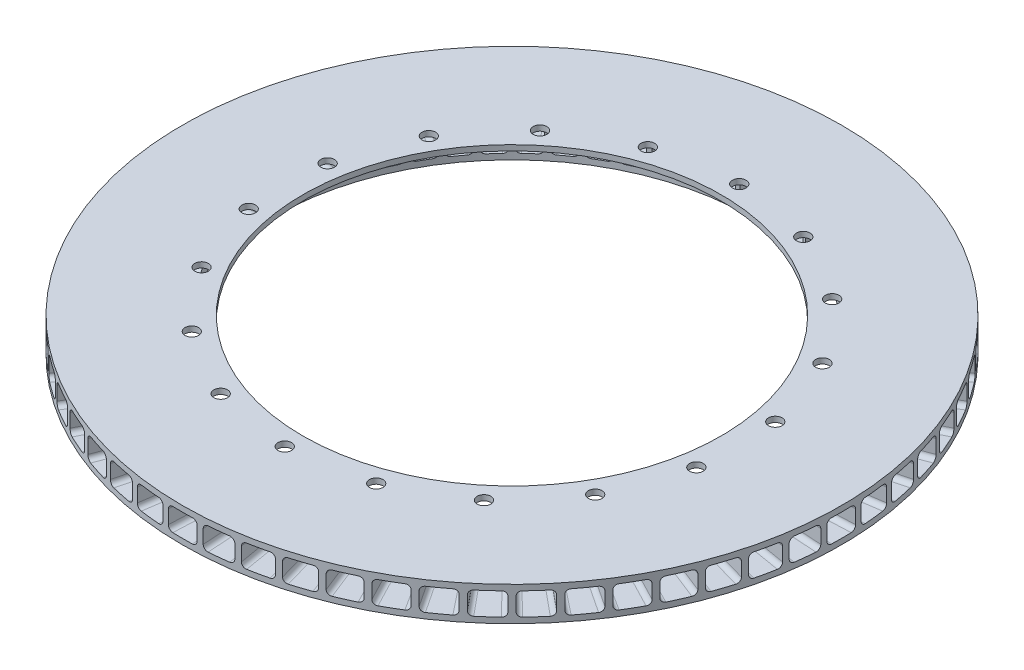
from build123d import *

# Parameters (mm, degrees)
SKETCH1_R           = 145
BOSS_EXTRUDE1_DEPTH = 7.5
CUT_EXTRUDE1_REACH  = 207.609
SKETCH2_R           = 105
SKETCH3_W           = 45
SKETCH3_H           = 10
CUT_REVOLVE1_ANGLE  = 5
CIRPATTERN1_COUNT   = 60
FILLET2_R           = 2
SKETCH6_R           = 105
SKETCH6_R_2         = 92
BOSS_EXTRUDE2_DEPTH = 2.4
CUT_EXTRUDE2_REACH  = 207.609
SKETCH7_R           = 3
CIRPATTERN2_COUNT   = 18


with BuildPart() as part:
    # Sketch1 → Boss-Extrude1 (new, symmetric)
    with BuildSketch(Plane(origin=(0, 0, 0), x_dir=(1, 0, 0), z_dir=(0, 1, 0))):
        Circle(SKETCH1_R)
    extrude(amount=BOSS_EXTRUDE1_DEPTH, both=True)

    # Sketch2 → Cut-Extrude1 (cut, up to next)
    with BuildSketch(Plane(origin=(0, 7.5, 0), x_dir=(1, 0, 0), z_dir=(0, 1, 0)), mode=Mode.PRIVATE) as cut_extrude1_sk1:
        Circle(SKETCH2_R)
    cut_extrude1_tool1 = extrude(cut_extrude1_sk1.sketch, amount=-CUT_EXTRUDE1_REACH, mode=Mode.PRIVATE) & part.part
    add(cut_extrude1_tool1.solids().sort_by_distance((0, 7.5, 0))[0], mode=Mode.SUBTRACT)

    # Sketch3 → Cut-Revolve1 (revolve, symmetric, cut)
    with BuildSketch(Plane(origin=(0, 0, 0), x_dir=(0, 0, -1), z_dir=(1, 0, 0))) as cut_revolve1_sk:
        with Locations((-126.5, 0)):
            Rectangle(SKETCH3_W, SKETCH3_H)
    cut_revolve1 = revolve(axis=Axis((0, 40.26124579, 0), (0, -1, 0)), revolution_arc=CUT_REVOLVE1_ANGLE / 2, mode=Mode.SUBTRACT)
    cut_revolve1 = cut_revolve1 + revolve(cut_revolve1_sk.sketch, axis=Axis((0, 40.26124579, 0), (0, 1, 0)), revolution_arc=CUT_REVOLVE1_ANGLE / 2, mode=Mode.SUBTRACT)

    # CirPattern1: Cut-Revolve1 ×60 about axis
    cirpattern1_axis = Axis((0, 7.5, 0), (0, 1, 0))
    for i in range(1, CIRPATTERN1_COUNT):
        add(cut_revolve1.rotate(cirpattern1_axis, i * 360 / CIRPATTERN1_COUNT), mode=Mode.SUBTRACT)

    # Fillet2
    fillet2_edges = [part.edges().sort_by_distance(p)[0] for p in [
        (-18.476176391, 5, 123.62698292),
        (-7.631067442, 5, 124.766849803),
        (-7.631067442, -5, 124.766849803),
        (-18.476176391, -5, 123.62698292),
        (-43.775922657, 5, 117.084023656),
        (-33.40479701, 5, 120.453806651),
        (-33.40479701, -5, 120.453806651),
        (-43.775922657, -5, 117.084023656),
        (-67.162451043, 5, 105.423930727),
        (-57.718576654, 5, 110.876354147),
        (-57.718576654, -5, 110.876354147),
        (-67.162451043, -5, 105.423930727),
        (-87.613658037, 5, 89.156306144),
        (-79.509777535, 5, 96.453072923),
        (-79.509777535, -5, 96.453072923),
        (-87.613658037, -5, 89.156306144),
        (-97.826019607, -5, 77.81432958),
        (-104.235727758, -5, 68.992123164),
        (-116.302195998, 5, 45.812653341),
        (-111.8667952, 5, 55.774726639),
        (-111.8667952, -5, 55.774726639),
        (-116.302195998, -5, 45.812653341),
        (-123.285700192, 5, 20.630950733),
        (-121.018455047, 5, 31.297500507),
        (-121.018455047, -5, 31.297500507),
        (-123.285700192, -5, 20.630950733),
        (-124.881027698, 5, -5.452423421),
        (-124.881027698, 5, 5.452423421),
        (-124.881027698, -5, 5.452423421),
        (-124.881027698, -5, -5.452423421),
        (-121.018455047, 5, -31.297500507),
        (-123.285700192, 5, -20.630950733),
        (-123.285700192, -5, -20.630950733),
        (-121.018455047, -5, -31.297500507),
        (-111.8667952, 5, -55.774726639),
        (-116.302195998, 5, -45.812653341),
        (-116.302195998, -5, -45.812653341),
        (-111.8667952, -5, -55.774726639),
        (-97.826019607, 5, -77.81432958),
        (-104.235727758, 5, -68.992123164),
        (-104.235727758, -5, -68.992123164),
        (-97.826019607, -5, -77.81432958),
        (-79.509777535, 5, -96.453072923),
        (-87.613658037, 5, -89.156306144),
        (-87.613658037, -5, -89.156306144),
        (-79.509777535, -5, -96.453072923),
        (-57.718576654, 5, -110.876354147),
        (-67.162451043, 5, -105.423930727),
        (-67.162451043, -5, -105.423930727),
        (-57.718576654, -5, -110.876354147),
        (-33.40479701, 5, -120.453806651),
        (-43.775922657, 5, -117.084023656),
        (-43.775922657, -5, -117.084023656),
        (-33.40479701, -5, -120.453806651),
        (-7.631067442, 5, -124.766849803),
        (-18.476176391, 5, -123.62698292),
        (-18.476176391, -5, -123.62698292),
        (-7.631067442, -5, -124.766849803),
        (18.476176391, 5, -123.62698292),
        (7.631067442, 5, -124.766849803),
        (7.631067442, -5, -124.766849803),
        (18.476176391, -5, -123.62698292),
        (43.775922657, 5, -117.084023656),
        (33.40479701, 5, -120.453806651),
        (33.40479701, -5, -120.453806651),
        (43.775922657, -5, -117.084023656),
        (67.162451043, 5, -105.423930727),
        (57.718576654, 5, -110.876354147),
        (57.718576654, -5, -110.876354147),
        (67.162451043, -5, -105.423930727),
        (87.613658037, 5, -89.156306144),
        (79.509777535, 5, -96.453072923),
        (79.509777535, -5, -96.453072923),
        (87.613658037, -5, -89.156306144),
        (104.235727758, 5, -68.992123164),
        (97.826019607, 5, -77.81432958),
        (97.826019607, -5, -77.81432958),
        (104.235727758, -5, -68.992123164),
        (116.302195998, 5, -45.812653341),
        (111.8667952, 5, -55.774726639),
        (111.8667952, -5, -55.774726639),
        (116.302195998, -5, -45.812653341),
        (123.285700192, 5, -20.630950733),
        (121.018455047, 5, -31.297500507),
        (121.018455047, -5, -31.297500507),
        (123.285700192, -5, -20.630950733),
        (124.881027698, 5, 5.452423421),
        (124.881027698, 5, -5.452423421),
        (124.881027698, -5, -5.452423421),
        (124.881027698, -5, 5.452423421),
        (121.018455047, 5, 31.297500507),
        (123.285700192, 5, 20.630950733),
        (123.285700192, -5, 20.630950733),
        (121.018455047, -5, 31.297500507),
        (111.8667952, 5, 55.774726639),
        (116.302195998, 5, 45.812653341),
        (116.302195998, -5, 45.812653341),
        (111.8667952, -5, 55.774726639),
        (97.826019607, 5, 77.81432958),
        (104.235727758, 5, 68.992123164),
        (104.235727758, -5, 68.992123164),
        (97.826019607, -5, 77.81432958),
        (79.509777535, 5, 96.453072923),
        (87.613658037, 5, 89.156306144),
        (87.613658037, -5, 89.156306144),
        (79.509777535, -5, 96.453072923),
        (57.718576654, 5, 110.876354147),
        (67.162451043, 5, 105.423930727),
        (67.162451043, -5, 105.423930727),
        (57.718576654, -5, 110.876354147),
        (33.40479701, 5, 120.453806651),
        (43.775922657, 5, 117.084023656),
        (43.775922657, -5, 117.084023656),
        (33.40479701, -5, 120.453806651),
        (7.631067442, 5, 124.766849803),
        (18.476176391, 5, 123.62698292),
        (18.476176391, -5, 123.62698292),
        (7.631067442, -5, 124.766849803),
        (-5.452423421, 5, 124.881027698),
        (5.452423421, 5, 124.881027698),
        (5.452423421, -5, 124.881027698),
        (-5.452423421, -5, 124.881027698),
        (20.630950733, 5, 123.285700192),
        (31.297500507, 5, 121.018455047),
        (31.297500507, -5, 121.018455047),
        (20.630950733, -5, 123.285700192),
        (45.812653341, 5, 116.302195998),
        (55.774726639, 5, 111.8667952),
        (55.774726639, -5, 111.8667952),
        (45.812653341, -5, 116.302195998),
        (68.992123164, 5, 104.235727758),
        (77.81432958, 5, 97.826019607),
        (77.81432958, -5, 97.826019607),
        (68.992123164, -5, 104.235727758),
        (89.156306144, 5, 87.613658037),
        (96.453072923, 5, 79.509777535),
        (96.453072923, -5, 79.509777535),
        (89.156306144, -5, 87.613658037),
        (105.423930727, 5, 67.162451043),
        (110.876354147, 5, 57.718576654),
        (110.876354147, -5, 57.718576654),
        (105.423930727, -5, 67.162451043),
        (117.084023656, 5, 43.775922657),
        (120.453806651, 5, 33.40479701),
        (120.453806651, -5, 33.40479701),
        (117.084023656, -5, 43.775922657),
        (123.62698292, 5, 18.476176391),
        (124.766849803, 5, 7.631067442),
        (124.766849803, -5, 7.631067442),
        (123.62698292, -5, 18.476176391),
        (124.766849803, 5, -7.631067442),
        (123.62698292, 5, -18.476176391),
        (123.62698292, -5, -18.476176391),
        (124.766849803, -5, -7.631067442),
        (120.453806651, 5, -33.40479701),
        (117.084023656, 5, -43.775922657),
        (117.084023656, -5, -43.775922657),
        (120.453806651, -5, -33.40479701),
        (110.876354147, 5, -57.718576654),
        (105.423930727, 5, -67.162451043),
        (105.423930727, -5, -67.162451043),
        (110.876354147, -5, -57.718576654),
        (96.453072923, 5, -79.509777535),
        (89.156306144, 5, -87.613658037),
        (89.156306144, -5, -87.613658037),
        (96.453072923, -5, -79.509777535),
        (77.81432958, 5, -97.826019607),
        (68.992123164, 5, -104.235727758),
        (68.992123164, -5, -104.235727758),
        (77.81432958, -5, -97.826019607),
        (55.774726639, 5, -111.8667952),
        (45.812653341, 5, -116.302195998),
        (45.812653341, -5, -116.302195998),
        (55.774726639, -5, -111.8667952),
        (31.297500507, 5, -121.018455047),
        (20.630950733, 5, -123.285700192),
        (20.630950733, -5, -123.285700192),
        (31.297500507, -5, -121.018455047),
        (5.452423421, 5, -124.881027698),
        (-5.452423421, 5, -124.881027698),
        (-5.452423421, -5, -124.881027698),
        (5.452423421, -5, -124.881027698),
        (-20.630950733, 5, -123.285700192),
        (-31.297500507, 5, -121.018455047),
        (-31.297500507, -5, -121.018455047),
        (-20.630950733, -5, -123.285700192),
        (-45.812653341, 5, -116.302195998),
        (-55.774726639, 5, -111.8667952),
        (-55.774726639, -5, -111.8667952),
        (-45.812653341, -5, -116.302195998),
        (-68.992123164, 5, -104.235727758),
        (-77.81432958, 5, -97.826019607),
        (-77.81432958, -5, -97.826019607),
        (-68.992123164, -5, -104.235727758),
        (-89.156306144, 5, -87.613658037),
        (-96.453072923, 5, -79.509777535),
        (-96.453072923, -5, -79.509777535),
        (-89.156306144, -5, -87.613658037),
        (-105.423930727, 5, -67.162451043),
        (-110.876354147, 5, -57.718576654),
        (-110.876354147, -5, -57.718576654),
        (-105.423930727, -5, -67.162451043),
        (-117.084023656, 5, -43.775922657),
        (-120.453806651, 5, -33.40479701),
        (-120.453806651, -5, -33.40479701),
        (-117.084023656, -5, -43.775922657),
        (-123.62698292, 5, -18.476176391),
        (-124.766849803, 5, -7.631067442),
        (-124.766849803, -5, -7.631067442),
        (-123.62698292, -5, -18.476176391),
        (-124.766849803, 5, 7.631067442),
        (-123.62698292, 5, 18.476176391),
        (-123.62698292, -5, 18.476176391),
        (-124.766849803, -5, 7.631067442),
        (-120.453806651, 5, 33.40479701),
        (-117.084023656, 5, 43.775922657),
        (-117.084023656, -5, 43.775922657),
        (-120.453806651, -5, 33.40479701),
        (-110.876354147, 5, 57.718576654),
        (-105.423930727, 5, 67.162451043),
        (-105.423930727, -5, 67.162451043),
        (-110.876354147, -5, 57.718576654),
        (-96.453072923, 5, 79.509777535),
        (-89.156306144, 5, 87.613658037),
        (-89.156306144, -5, 87.613658037),
        (-96.453072923, -5, 79.509777535),
        (-77.81432958, 5, 97.826019607),
        (-68.992123164, 5, 104.235727758),
        (-68.992123164, -5, 104.235727758),
        (-77.81432958, -5, 97.826019607),
        (-55.774726639, 5, 111.8667952),
        (-45.812653341, 5, 116.302195998),
        (-45.812653341, -5, 116.302195998),
        (-55.774726639, -5, 111.8667952),
        (-31.297500507, 5, 121.018455047),
        (-20.630950733, 5, 123.285700192),
        (-20.630950733, -5, 123.285700192),
        (-31.297500507, -5, 121.018455047),
        (-97.826019607, 5, 77.81432958),
        (-104.235727758, 5, 68.992123164),
    ]]
    fillet(fillet2_edges, radius=FILLET2_R)

    # Sketch6 → Boss-Extrude2 (add)
    with BuildSketch(Plane(origin=(0, 7.5, 0), x_dir=(1, 0, 0), z_dir=(0, 1, 0))):
        Circle(SKETCH6_R)
        Circle(SKETCH6_R_2, mode=Mode.SUBTRACT)
    extrude(amount=-BOSS_EXTRUDE2_DEPTH)

    # Sketch7 → Cut-Extrude2 (cut, up to next)
    with BuildSketch(Plane(origin=(0, 7.5, 0), x_dir=(1, 0, 0), z_dir=(0, 1, 0)), mode=Mode.PRIVATE) as cut_extrude2_sk1:
        with Locations((0, 100)):
            Circle(SKETCH7_R)
    cut_extrude2_tool1 = extrude(cut_extrude2_sk1.sketch, amount=-CUT_EXTRUDE2_REACH, mode=Mode.PRIVATE) & part.part
    cut_extrude2 = cut_extrude2_tool1.solids().sort_by_distance((0, 7.5, -100))[0]
    add(cut_extrude2, mode=Mode.SUBTRACT)

    # CirPattern2: Cut-Extrude2 ×18 about axis
    cirpattern2_axis = Axis((0, 5.1, 0), (0, 1, 0))
    for i in range(1, CIRPATTERN2_COUNT):
        add(cut_extrude2.rotate(cirpattern2_axis, i * 360 / CIRPATTERN2_COUNT), mode=Mode.SUBTRACT)


solid = part.part
